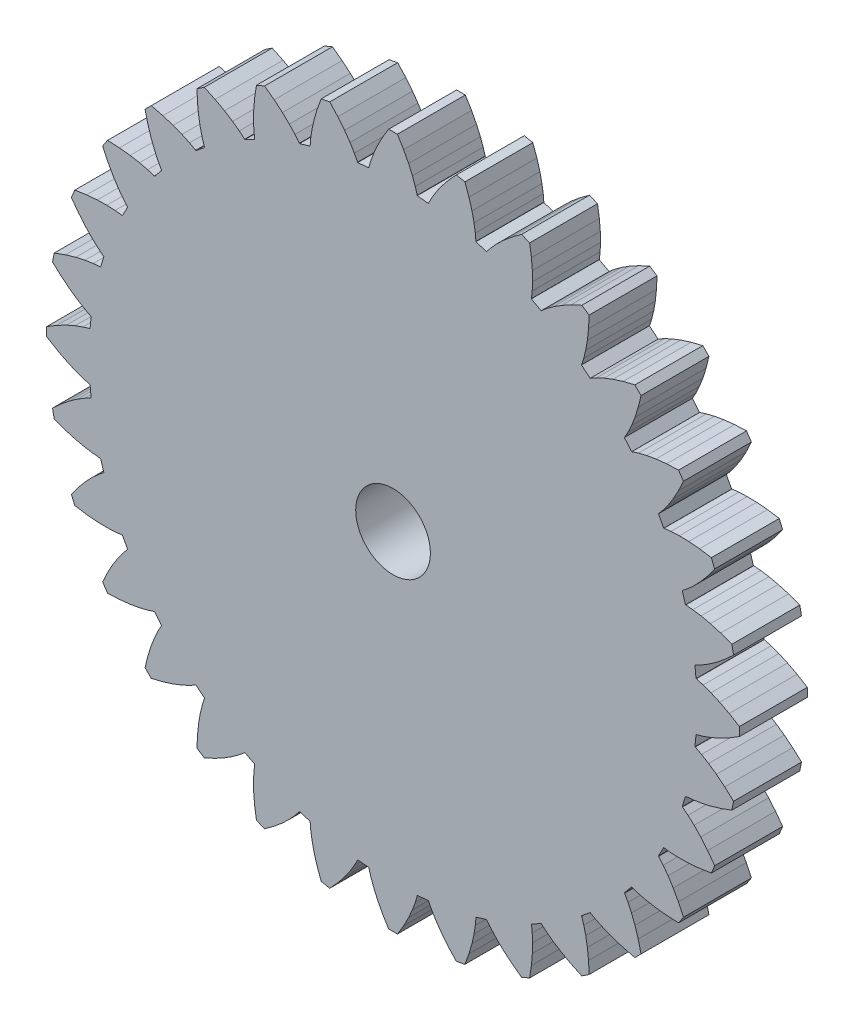
from build123d import *
from OCP.BRepFilletAPI import BRepFilletAPI_MakeChamfer

# Parameters (mm, degrees)
BOSS_EXTRUDE1_DEPTH  = 4.999999888
BOSS_EXTRUDE2_DEPTH  = 9.999999776
CUT_EXTRUDE1_DEPTH   = 40.748070134
CHAMFER1_SIZE        = 0.619803471
CHAMFER1_SIZE2       = 0.619822096
CHAMFER2_SIZE        = 0.619726875
CHAMFER2_SIZE2       = 0.619893824
CHAMFER3_SIZE        = 0.619793515
CHAMFER3_SIZE2       = 0.619793526
CHAMFER4_SIZE        = 0.619822096
CHAMFER4_SIZE2       = 0.619803471
CHAMFER5_SIZE        = 0.619726875
CHAMFER5_SIZE2       = 0.619893824
CHAMFER6_SIZE        = 0.619893824
CHAMFER6_SIZE2       = 0.619726875
CHAMFER7_SIZE        = 0.619893824
CHAMFER7_SIZE2       = 0.619726875
CHAMFER8_SIZE        = 0.619745054
CHAMFER8_SIZE2       = 0.619765581
CHAMFER9_SIZE        = 0.619714154
CHAMFER9_EDGE_2_SIZE = 0.619714154
CHAMFER9_EDGE_3_SIZE = 0.619714154
CHAMFER9_EDGE_4_SIZE = 0.619714154
CHAMFER10_SIZE       = 0.619765581
CHAMFER10_SIZE2      = 0.619745054
CHAMFER11_SIZE       = 0.619793526
CHAMFER11_SIZE2      = 0.619793515
SKETCH4_R            = 2.75
CUT_EXTRUDE2_DEPTH   = 4.999999888


with BuildPart() as part:
    # Sketch1 → Boss-Extrude1 (new body)
    with BuildSketch(Plane.XY.offset(4.999999888)):
        Polygon((1.778639969, 22.306099534), (1.780470018, 22.329099476), (1.634810003, 22.827899083), (1.425980008, 23.401200771), (1.143750036, 24.0423996), (0.778533984, 24.744199589), (7.504e-06, 26.027956983), (-0.778519025, 24.744199589), (-1.143740024, 24.0423996), (-1.425959985, 23.401200771), (-1.634799992, 22.827899083), (-1.780460007, 22.329099476), (-1.778629958, 22.306099534), (-2.607240109, 22.224500775), (-2.609919989, 22.247400135), (-2.850099932, 22.708199918), (-3.166760085, 23.229699582), (-3.568660002, 23.803599179), (-4.063770175, 24.420600384), (-5.077812133, 25.527785712), (-5.590910092, 24.116799235), (-5.812210031, 23.357300088), (-5.963909905, 22.673299536), (-6.056900136, 22.070299834), (-6.102450192, 21.552700549), (-6.096160039, 21.530499682), (-6.892929785, 21.288799122), (-6.900039967, 21.310800686), (-7.225490175, 21.715899929), (-7.637800183, 22.16560021), (-8.143940009, 22.649999708), (-8.749909699, 23.158600554), (-9.960546657, 24.046648865), (-10.188399814, 22.562699392), (-10.257299989, 21.774599329), (-10.27270034, 21.074200049), (-10.246199556, 20.464599133), (-10.189900175, 19.948000088), (-10.179400444, 19.927499816), (-10.913699865, 19.534999505), (-10.924999602, 19.555099308), (-11.323199607, 19.889000803), (-11.815300211, 20.249599591), (-12.406200171, 20.625999197), (-13.099799864, 21.006500348), (-14.460307649, 21.641368666), (-14.39439971, 20.141499117), (-14.308200218, 19.355099648), (-14.186600223, 18.665099517), (-14.041800052, 18.072400242), (-13.885799795, 17.576800659), (-13.871500269, 17.558699474), (-14.515100047, 17.030499876), (-14.530099928, 17.047999427), (-14.985799789, 17.297700047), (-15.538799576, 17.555499449), (-16.191799194, 17.809299752), (-16.946300864, 18.047299236), (-18.404422827, 18.404422827), (-18.047299236, 16.946300864), (-17.809299752, 16.191799194), (-17.555499449, 15.538799576), (-17.297700047, 14.985799789), (-17.047999427, 14.530099928), (-17.030499876, 14.515100047), (-17.558699474, 13.871500269), (-17.576800659, 13.885799795), (-18.072400242, 14.041800052), (-18.665099517, 14.186600223), (-19.355099648, 14.308200218), (-20.141499117, 14.39439971), (-21.641368666, 14.460307649), (-21.006500348, 13.099799864), (-20.625999197, 12.406200171), (-20.249599591, 11.815300211), (-19.889000803, 11.323199607), (-19.555099308, 10.924999602), (-19.534999505, 10.913699865), (-19.927499816, 10.179400444), (-19.948000088, 10.189900175), (-20.464599133, 10.246199556), (-21.074200049, 10.27270034), (-21.774599329, 10.257299989), (-22.562699392, 10.188399814), (-24.046648865, 9.960546657), (-23.158600554, 8.749909699), (-22.649999708, 8.143940009), (-22.16560021, 7.637800183), (-21.715899929, 7.225490175), (-21.310800686, 6.900039967), (-21.288799122, 6.892929785), (-21.530499682, 6.096160039), (-21.552700549, 6.102450192), (-22.070299834, 6.056900136), (-22.673299536, 5.963909905), (-23.357300088, 5.812210031), (-24.116799235, 5.590910092), (-25.527785712, 5.077812133), (-24.420600384, 4.063770175), (-23.803599179, 3.568660002), (-23.229699582, 3.166760085), (-22.708199918, 2.850099932), (-22.247400135, 2.609919989), (-22.224500775, 2.607240109), (-22.306099534, 1.778639969), (-22.329099476, 1.780470018), (-22.827899083, 1.634810003), (-23.401200771, 1.425980008), (-24.0423996, 1.143750036), (-24.744199589, 0.778533984), (-26.027956983, 7.504e-06), (-24.744199589, -0.778519025), (-24.0423996, -1.143740024), (-23.401200771, -1.425959985), (-22.827899083, -1.634799992), (-22.329099476, -1.780460007), (-22.306099534, -1.778629958), (-22.224500775, -2.607240109), (-22.247400135, -2.609919989), (-22.708199918, -2.850099932), (-23.229699582, -3.166760085), (-23.803599179, -3.568660002), (-24.420600384, -4.063770175), (-25.527785712, -5.077812133), (-24.116799235, -5.590910092), (-23.357300088, -5.812210031), (-22.673299536, -5.963909905), (-22.070299834, -6.056900136), (-21.552700549, -6.102450192), (-21.530499682, -6.096160039), (-21.288799122, -6.892929785), (-21.310800686, -6.900039967), (-21.715899929, -7.225490175), (-22.16560021, -7.637800183), (-22.649999708, -8.143940009), (-23.158600554, -8.749909699), (-24.046648865, -9.960546657), (-22.562699392, -10.188399814), (-21.774599329, -10.257299989), (-21.074200049, -10.27270034), (-20.464599133, -10.246199556), (-19.948000088, -10.189900175), (-19.927499816, -10.179400444), (-19.534999505, -10.913699865), (-19.555099308, -10.924999602), (-19.889000803, -11.323199607), (-20.249599591, -11.815300211), (-20.625999197, -12.406200171), (-21.006500348, -13.099799864), (-21.641368666, -14.460307649), (-20.141499117, -14.39439971), (-19.355099648, -14.308200218), (-18.665099517, -14.186600223), (-18.072400242, -14.041800052), (-17.576800659, -13.885799795), (-17.558699474, -13.871500269), (-17.030499876, -14.515100047), (-17.047999427, -14.530099928), (-17.297700047, -14.985799789), (-17.555499449, -15.538799576), (-17.809299752, -16.191799194), (-18.047299236, -16.946300864), (-18.404422827, -18.404422827), (-16.946300864, -18.047299236), (-16.191799194, -17.809299752), (-15.538799576, -17.555499449), (-14.985799789, -17.297700047), (-14.530099928, -17.047999427), (-14.515100047, -17.030499876), (-13.871500269, -17.558699474), (-13.885799795, -17.576800659), (-14.041800052, -18.072400242), (-14.186600223, -18.665099517), (-14.308200218, -19.355099648), (-14.39439971, -20.141499117), (-14.460307649, -21.641368666), (-13.099799864, -21.006500348), (-12.406200171, -20.625999197), (-11.815300211, -20.249599591), (-11.323199607, -19.889000803), (-10.924999602, -19.555099308), (-10.913699865, -19.534999505), (-10.179400444, -19.927499816), (-10.189900175, -19.948000088), (-10.246199556, -20.464599133), (-10.27270034, -21.074200049), (-10.257299989, -21.774599329), (-10.188399814, -22.562699392), (-9.960546657, -24.046648865), (-8.749909699, -23.158600554), (-8.143940009, -22.649999708), (-7.637800183, -22.16560021), (-7.225490175, -21.715899929), (-6.900039967, -21.310800686), (-6.892929785, -21.288799122), (-6.096160039, -21.530499682), (-6.102450192, -21.552700549), (-6.056900136, -22.070299834), (-5.963909905, -22.673299536), (-5.812210031, -23.357300088), (-5.590910092, -24.116799235), (-5.077812133, -25.527785712), (-4.063770175, -24.420600384), (-3.568660002, -23.803599179), (-3.166760085, -23.229699582), (-2.850099932, -22.708199918), (-2.609919989, -22.247400135), (-2.607240109, -22.224500775), (-1.778639969, -22.306099534), (-1.780470018, -22.329099476), (-1.634810003, -22.827899083), (-1.425980008, -23.401200771), (-1.143750036, -24.0423996), (-0.778533984, -24.744199589), (-7.504e-06, -26.027956983), (0.778519025, -24.744199589), (1.143740024, -24.0423996), (1.425959985, -23.401200771), (1.634799992, -22.827899083), (1.780460007, -22.329099476), (1.778629958, -22.306099534), (2.607240109, -22.224500775), (2.609919989, -22.247400135), (2.850099932, -22.708199918), (3.166760085, -23.229699582), (3.568660002, -23.803599179), (4.063770175, -24.420600384), (5.077812133, -25.527785712), (5.590910092, -24.116799235), (5.812210031, -23.357300088), (5.963909905, -22.673299536), (6.056900136, -22.070299834), (6.102450192, -21.552700549), (6.096160039, -21.530499682), (6.892929785, -21.288799122), (6.900039967, -21.310800686), (7.225490175, -21.715899929), (7.637800183, -22.16560021), (8.143940009, -22.649999708), (8.749909699, -23.158600554), (9.960546657, -24.046648865), (10.188399814, -22.562699392), (10.257299989, -21.774599329), (10.27270034, -21.074200049), (10.246199556, -20.464599133), (10.189900175, -19.948000088), (10.179400444, -19.927499816), (10.913699865, -19.534999505), (10.924999602, -19.555099308), (11.323199607, -19.889000803), (11.815300211, -20.249599591), (12.406200171, -20.625999197), (13.099799864, -21.006500348), (14.460307649, -21.641368666), (14.39439971, -20.141499117), (14.308200218, -19.355099648), (14.186600223, -18.665099517), (14.041800052, -18.072400242), (13.885799795, -17.576800659), (13.871500269, -17.558699474), (14.515100047, -17.030499876), (14.530099928, -17.047999427), (14.985799789, -17.297700047), (15.538799576, -17.555499449), (16.191799194, -17.809299752), (16.946300864, -18.047299236), (18.404422827, -18.404422827), (18.047299236, -16.946300864), (17.809299752, -16.191799194), (17.555499449, -15.538799576), (17.297700047, -14.985799789), (17.047999427, -14.530099928), (17.030499876, -14.515100047), (17.558699474, -13.871500269), (17.576800659, -13.885799795), (18.072400242, -14.041800052), (18.665099517, -14.186600223), (19.355099648, -14.308200218), (20.141499117, -14.39439971), (21.641368666, -14.460307649), (21.006500348, -13.099799864), (20.625999197, -12.406200171), (20.249599591, -11.815300211), (19.889000803, -11.323199607), (19.555099308, -10.924999602), (19.534999505, -10.913699865), (19.927499816, -10.179400444), (19.948000088, -10.189900175), (20.464599133, -10.246199556), (21.074200049, -10.27270034), (21.774599329, -10.257299989), (22.562699392, -10.188399814), (24.046648865, -9.960546657), (23.158600554, -8.749909699), (22.649999708, -8.143940009), (22.16560021, -7.637800183), (21.715899929, -7.225490175), (21.310800686, -6.900039967), (21.288799122, -6.892929785), (21.530499682, -6.096160039), (21.552700549, -6.102450192), (22.070299834, -6.056900136), (22.673299536, -5.963909905), (23.357300088, -5.812210031), (24.116799235, -5.590910092), (25.527785712, -5.077812133), (24.420600384, -4.063770175), (23.803599179, -3.568660002), (23.229699582, -3.166760085), (22.708199918, -2.850099932), (22.247400135, -2.609919989), (22.224500775, -2.607240109), (22.306099534, -1.778639969), (22.329099476, -1.780470018), (22.827899083, -1.634810003), (23.401200771, -1.425980008), (24.0423996, -1.143750036), (24.744199589, -0.778533984), (26.027956983, -7.504e-06), (24.744199589, 0.778519025), (24.0423996, 1.143740024), (23.401200771, 1.425959985), (22.827899083, 1.634799992), (22.329099476, 1.780460007), (22.306099534, 1.778629958), (22.224500775, 2.607240109), (22.247400135, 2.609919989), (22.708199918, 2.850099932), (23.229699582, 3.166760085), (23.803599179, 3.568660002), (24.420600384, 4.063770175), (25.527785712, 5.077812133), (24.116799235, 5.590910092), (23.357300088, 5.812210031), (22.673299536, 5.963909905), (22.070299834, 6.056900136), (21.552700549, 6.102450192), (21.530499682, 6.096160039), (21.288799122, 6.892929785), (21.310800686, 6.900039967), (21.715899929, 7.225490175), (22.16560021, 7.637800183), (22.649999708, 8.143940009), (23.158600554, 8.749909699), (24.046648865, 9.960546657), (22.562699392, 10.188399814), (21.774599329, 10.257299989), (21.074200049, 10.27270034), (20.464599133, 10.246199556), (19.948000088, 10.189900175), (19.927499816, 10.179400444), (19.534999505, 10.913699865), (19.555099308, 10.924999602), (19.889000803, 11.323199607), (20.249599591, 11.815300211), (20.625999197, 12.406200171), (21.006500348, 13.099799864), (21.641368666, 14.460307649), (20.141499117, 14.39439971), (19.355099648, 14.308200218), (18.665099517, 14.186600223), (18.072400242, 14.041800052), (17.576800659, 13.885799795), (17.558699474, 13.871500269), (17.030499876, 14.515100047), (17.047999427, 14.530099928), (17.297700047, 14.985799789), (17.555499449, 15.538799576), (17.809299752, 16.191799194), (18.047299236, 16.946300864), (18.404422827, 18.404422827), (16.946300864, 18.047299236), (16.191799194, 17.809299752), (15.538799576, 17.555499449), (14.985799789, 17.297700047), (14.530099928, 17.047999427), (14.515100047, 17.030499876), (13.871500269, 17.558699474), (13.885799795, 17.576800659), (14.041800052, 18.072400242), (14.186600223, 18.665099517), (14.308200218, 19.355099648), (14.39439971, 20.141499117), (14.460307649, 21.641368666), (13.099799864, 21.006500348), (12.406200171, 20.625999197), (11.815300211, 20.249599591), (11.323199607, 19.889000803), (10.924999602, 19.555099308), (10.913699865, 19.534999505), (10.179400444, 19.927499816), (10.189900175, 19.948000088), (10.246199556, 20.464599133), (10.27270034, 21.074200049), (10.257299989, 21.774599329), (10.188399814, 22.562699392), (9.960546657, 24.046648865), (8.749909699, 23.158600554), (8.143940009, 22.649999708), (7.637800183, 22.16560021), (7.225490175, 21.715899929), (6.900039967, 21.310800686), (6.892929785, 21.288799122), (6.096160039, 21.530499682), (6.102450192, 21.552700549), (6.056900136, 22.070299834), (5.963909905, 22.673299536), (5.812210031, 23.357300088), (5.590910092, 24.116799235), (5.077812133, 25.527785712), (4.063770175, 24.420600384), (3.568660002, 23.803599179), (3.166760085, 23.229699582), (2.850099932, 22.708199918), (2.609919989, 22.247400135), (2.607240109, 22.224500775), align=None)
    extrude(amount=-BOSS_EXTRUDE1_DEPTH)

    # Sketch2 → Boss-Extrude2 (add)
    with BuildSketch(Plane.XY.offset(4.999999888)):
        Polygon((-7.499999832, 0), (-7.244439796, 1.941140043), (-6.495189853, 3.749999916), (-5.303299986, 5.303299986), (-3.749999916, 6.495189853), (-1.941140043, 7.244439796), (0, 7.499999832), (1.941140043, 7.244439796), (3.749999916, 6.495189853), (5.303299986, 5.303299986), (6.495189853, 3.749999916), (7.244439796, 1.941140043), (7.499999832, 0), (7.244439796, -1.941140043), (6.495189853, -3.749999916), (5.303299986, -5.303299986), (3.749999916, -6.495189853), (1.941140043, -7.244439796), (0, -7.499999832), (-1.941140043, -7.244439796), (-3.749999916, -6.495189853), (-5.303299986, -5.303299986), (-6.495189853, -3.749999916), (-7.244439796, -1.941140043), align=None)
    extrude(amount=BOSS_EXTRUDE2_DEPTH)

    # Sketch3 → Cut-Extrude1 (cut, through all)
    with BuildSketch(Plane(origin=(0, 0, 0), x_dir=(-1, 0, 0), z_dir=(0, 0, -1))):
        Polygon((1.767770038, 1.767770038), (0, 2.499999944), (-1.767770038, 1.767770038), (-2.499999944, 0), (-1.767770038, -1.767770038), (0, -2.499999944), (1.767770038, -1.767770038), (2.499999944, 0), align=None)
    extrude(amount=-CUT_EXTRUDE1_DEPTH, mode=Mode.SUBTRACT)

    # Chamfer1: one chamfer whose edges measure the first distance from different faces: ONE call of the kernel's chamfer builder (chamfer() names one face for all edges)
    chamfer1_edges_1 = [part.edges().sort_by_distance(p)[0] for p in [
        (25.527785712, -5.077812133, 2.499999944),
    ]]
    chamfer1_side_1 = [part.faces().sort_by_distance(p)[0] for p in [
        (24.974193048, -4.570791154, 2.499999944),
    ]]
    chamfer1_edges_2 = [part.edges().sort_by_distance(p)[0] for p in [
        (-5.077812133, -25.527785712, 2.499999944),
    ]]
    chamfer1_side_2 = [part.faces().sort_by_distance(p)[0] for p in [
        (-5.334361112, -24.822292473, 2.499999944),
    ]]
    chamfer1_edges_3 = [part.edges().sort_by_distance(p)[0] for p in [
        (-25.527785712, 5.077812133, 2.499999944),
    ]]
    chamfer1_side_3 = [part.faces().sort_by_distance(p)[0] for p in [
        (-24.822292473, 5.334361112, 2.499999944),
    ]]
    chamfer1_edges_4 = [part.edges().sort_by_distance(p)[0] for p in [
        (-5.077812133, 25.527785712, 2.499999944),
    ]]
    chamfer1_side_4 = [part.faces().sort_by_distance(p)[0] for p in [
        (-4.570791154, 24.974193048, 2.499999944),
    ]]
    chamfer1 = BRepFilletAPI_MakeChamfer(part.part.solid().wrapped)
    for e in chamfer1_edges_1:
        chamfer1.Add(CHAMFER1_SIZE, CHAMFER1_SIZE2, e.wrapped, chamfer1_side_1[0].wrapped)  # the first distance lies on this face
    for e in chamfer1_edges_2:
        chamfer1.Add(CHAMFER1_SIZE, CHAMFER1_SIZE2, e.wrapped, chamfer1_side_2[0].wrapped)  # the first distance lies on this face
    for e in chamfer1_edges_3:
        chamfer1.Add(CHAMFER1_SIZE, CHAMFER1_SIZE2, e.wrapped, chamfer1_side_3[0].wrapped)  # the first distance lies on this face
    for e in chamfer1_edges_4:
        chamfer1.Add(CHAMFER1_SIZE, CHAMFER1_SIZE2, e.wrapped, chamfer1_side_4[0].wrapped)  # the first distance lies on this face
    add(Compound.cast(chamfer1.Shape()), mode=Mode.REPLACE)

    # Chamfer2: one chamfer whose edges measure the first distance from different faces: ONE call of the kernel's chamfer builder (chamfer() names one face for all edges)
    chamfer2_edges_1 = [part.edges().sort_by_distance(p)[0] for p in [
        (24.046648865, -9.960546657, 2.499999944),
    ]]
    chamfer2_side_1 = [part.faces().sort_by_distance(p)[0] for p in [
        (23.602624709, -9.355228178, 2.499999944),
    ]]
    chamfer2_edges_2 = [part.edges().sort_by_distance(p)[0] for p in [
        (-24.046648865, -9.960546657, 2.499999944),
    ]]
    chamfer2_side_2 = [part.faces().sort_by_distance(p)[0] for p in [
        (-23.602624709, -9.355228178, 2.499999944),
    ]]
    chamfer2_edges_3 = [part.edges().sort_by_distance(p)[0] for p in [
        (-24.046648865, 9.960546657, 2.499999944),
    ]]
    chamfer2_side_3 = [part.faces().sort_by_distance(p)[0] for p in [
        (-23.304674129, 10.074473236, 2.499999944),
    ]]
    chamfer2 = BRepFilletAPI_MakeChamfer(part.part.solid().wrapped)
    for e in chamfer2_edges_1:
        chamfer2.Add(CHAMFER2_SIZE, CHAMFER2_SIZE2, e.wrapped, chamfer2_side_1[0].wrapped)  # the first distance lies on this face
    for e in chamfer2_edges_2:
        chamfer2.Add(CHAMFER2_SIZE, CHAMFER2_SIZE2, e.wrapped, chamfer2_side_2[0].wrapped)  # the first distance lies on this face
    for e in chamfer2_edges_3:
        chamfer2.Add(CHAMFER2_SIZE, CHAMFER2_SIZE2, e.wrapped, chamfer2_side_3[0].wrapped)  # the first distance lies on this face
    add(Compound.cast(chamfer2.Shape()), mode=Mode.REPLACE)

    # Chamfer3: one chamfer whose edges measure the first distance from different faces: ONE call of the kernel's chamfer builder (chamfer() names one face for all edges)
    chamfer3_edges_1 = [part.edges().sort_by_distance(p)[0] for p in [
        (26.027956983, -7.504e-06, 2.499999944),
    ]]
    chamfer3_side_1 = [part.faces().sort_by_distance(p)[0] for p in [
        (25.386078286, 0.38925576, 2.499999944),
    ]]
    chamfer3_edges_2 = [part.edges().sort_by_distance(p)[0] for p in [
        (-26.027956983, 7.504e-06, 2.499999944),
    ]]
    chamfer3_side_2 = [part.faces().sort_by_distance(p)[0] for p in [
        (-25.386078286, 0.389270744, 2.499999944),
    ]]
    chamfer3 = BRepFilletAPI_MakeChamfer(part.part.solid().wrapped)
    for e in chamfer3_edges_1:
        chamfer3.Add(CHAMFER3_SIZE, CHAMFER3_SIZE2, e.wrapped, chamfer3_side_1[0].wrapped)  # the first distance lies on this face
    for e in chamfer3_edges_2:
        chamfer3.Add(CHAMFER3_SIZE, CHAMFER3_SIZE2, e.wrapped, chamfer3_side_2[0].wrapped)  # the first distance lies on this face
    add(Compound.cast(chamfer3.Shape()), mode=Mode.REPLACE)

    # Chamfer4: one chamfer whose edges measure the first distance from different faces: ONE call of the kernel's chamfer builder (chamfer() names one face for all edges)
    chamfer4_edges_1 = [part.edges().sort_by_distance(p)[0] for p in [
        (5.077812133, 25.527785712, 2.499999944),
    ]]
    chamfer4_side_1 = [part.faces().sort_by_distance(p)[0] for p in [
        (4.570791154, 24.974193048, 2.499999944),
    ]]
    chamfer4_edges_2 = [part.edges().sort_by_distance(p)[0] for p in [
        (25.527785712, 5.077812133, 2.499999944),
    ]]
    chamfer4_side_2 = [part.faces().sort_by_distance(p)[0] for p in [
        (24.822292473, 5.334361112, 2.499999944),
    ]]
    chamfer4_edges_3 = [part.edges().sort_by_distance(p)[0] for p in [
        (5.077812133, -25.527785712, 2.499999944),
    ]]
    chamfer4_side_3 = [part.faces().sort_by_distance(p)[0] for p in [
        (4.570791154, -24.974193048, 2.499999944),
    ]]
    chamfer4_edges_4 = [part.edges().sort_by_distance(p)[0] for p in [
        (-25.527785712, -5.077812133, 2.499999944),
    ]]
    chamfer4_side_4 = [part.faces().sort_by_distance(p)[0] for p in [
        (-24.974193048, -4.570791154, 2.499999944),
    ]]
    chamfer4 = BRepFilletAPI_MakeChamfer(part.part.solid().wrapped)
    for e in chamfer4_edges_1:
        chamfer4.Add(CHAMFER4_SIZE, CHAMFER4_SIZE2, e.wrapped, chamfer4_side_1[0].wrapped)  # the first distance lies on this face
    for e in chamfer4_edges_2:
        chamfer4.Add(CHAMFER4_SIZE, CHAMFER4_SIZE2, e.wrapped, chamfer4_side_2[0].wrapped)  # the first distance lies on this face
    for e in chamfer4_edges_3:
        chamfer4.Add(CHAMFER4_SIZE, CHAMFER4_SIZE2, e.wrapped, chamfer4_side_3[0].wrapped)  # the first distance lies on this face
    for e in chamfer4_edges_4:
        chamfer4.Add(CHAMFER4_SIZE, CHAMFER4_SIZE2, e.wrapped, chamfer4_side_4[0].wrapped)  # the first distance lies on this face
    add(Compound.cast(chamfer4.Shape()), mode=Mode.REPLACE)

    # Chamfer5: one chamfer whose edges measure the first distance from different faces: ONE call of the kernel's chamfer builder (chamfer() names one face for all edges)
    chamfer5_edges_1 = [part.edges().sort_by_distance(p)[0] for p in [
        (9.960546657, 24.046648865, 2.499999944),
    ]]
    chamfer5_side_1 = [part.faces().sort_by_distance(p)[0] for p in [
        (9.355228178, 23.602624709, 2.499999944),
    ]]
    chamfer5_edges_2 = [part.edges().sort_by_distance(p)[0] for p in [
        (9.960546657, -24.046648865, 2.499999944),
    ]]
    chamfer5_side_2 = [part.faces().sort_by_distance(p)[0] for p in [
        (9.355228178, -23.602624709, 2.499999944),
    ]]
    chamfer5_edges_3 = [part.edges().sort_by_distance(p)[0] for p in [
        (-9.960546657, 24.046648865, 2.499999944),
    ]]
    chamfer5_side_3 = [part.faces().sort_by_distance(p)[0] for p in [
        (-10.074473236, 23.304674129, 2.499999944),
    ]]
    chamfer5 = BRepFilletAPI_MakeChamfer(part.part.solid().wrapped)
    for e in chamfer5_edges_1:
        chamfer5.Add(CHAMFER5_SIZE, CHAMFER5_SIZE2, e.wrapped, chamfer5_side_1[0].wrapped)  # the first distance lies on this face
    for e in chamfer5_edges_2:
        chamfer5.Add(CHAMFER5_SIZE, CHAMFER5_SIZE2, e.wrapped, chamfer5_side_2[0].wrapped)  # the first distance lies on this face
    for e in chamfer5_edges_3:
        chamfer5.Add(CHAMFER5_SIZE, CHAMFER5_SIZE2, e.wrapped, chamfer5_side_3[0].wrapped)  # the first distance lies on this face
    add(Compound.cast(chamfer5.Shape()), mode=Mode.REPLACE)

    # Chamfer6
    chamfer6_edges = [part.edges().sort_by_distance(p)[0] for p in [
        (-9.960546657, -24.046648865, 2.499999944),
    ]]
    chamfer6_side = [part.faces().sort_by_distance(p)[0] for p in [
        (-10.074473236, -23.304674129, 2.499999944),
    ]]
    chamfer(chamfer6_edges, length=CHAMFER6_SIZE, length2=CHAMFER6_SIZE2, reference=chamfer6_side[0])

    # Chamfer7
    chamfer7_edges = [part.edges().sort_by_distance(p)[0] for p in [
        (24.046648865, 9.960546657, 2.499999944),
    ]]
    chamfer7_side = [part.faces().sort_by_distance(p)[0] for p in [
        (23.602624709, 9.355228178, 2.499999944),
    ]]
    chamfer(chamfer7_edges, length=CHAMFER7_SIZE, length2=CHAMFER7_SIZE2, reference=chamfer7_side[0])

    # Chamfer8: one chamfer whose edges measure the first distance from different faces: ONE call of the kernel's chamfer builder (chamfer() names one face for all edges)
    chamfer8_edges_1 = [part.edges().sort_by_distance(p)[0] for p in [
        (21.641368666, 14.460307649, 2.499999944),
    ]]
    chamfer8_side_1 = [part.faces().sort_by_distance(p)[0] for p in [
        (21.323934507, 13.780053757, 2.499999944),
    ]]
    chamfer8_edges_2 = [part.edges().sort_by_distance(p)[0] for p in [
        (14.460307649, -21.641368666, 2.499999944),
    ]]
    chamfer8_side_2 = [part.faces().sort_by_distance(p)[0] for p in [
        (14.42735368, -20.891433892, 2.499999944),
    ]]
    chamfer8_edges_3 = [part.edges().sort_by_distance(p)[0] for p in [
        (-14.460307649, -21.641368666, 2.499999944),
    ]]
    chamfer8_side_3 = [part.faces().sort_by_distance(p)[0] for p in [
        (-13.780053757, -21.323934507, 2.499999944),
    ]]
    chamfer8_edges_4 = [part.edges().sort_by_distance(p)[0] for p in [
        (-14.460307649, 21.641368666, 2.499999944),
    ]]
    chamfer8_side_4 = [part.faces().sort_by_distance(p)[0] for p in [
        (-13.780053757, 21.323934507, 2.499999944),
    ]]
    chamfer8 = BRepFilletAPI_MakeChamfer(part.part.solid().wrapped)
    for e in chamfer8_edges_1:
        chamfer8.Add(CHAMFER8_SIZE, CHAMFER8_SIZE2, e.wrapped, chamfer8_side_1[0].wrapped)  # the first distance lies on this face
    for e in chamfer8_edges_2:
        chamfer8.Add(CHAMFER8_SIZE, CHAMFER8_SIZE2, e.wrapped, chamfer8_side_2[0].wrapped)  # the first distance lies on this face
    for e in chamfer8_edges_3:
        chamfer8.Add(CHAMFER8_SIZE, CHAMFER8_SIZE2, e.wrapped, chamfer8_side_3[0].wrapped)  # the first distance lies on this face
    for e in chamfer8_edges_4:
        chamfer8.Add(CHAMFER8_SIZE, CHAMFER8_SIZE2, e.wrapped, chamfer8_side_4[0].wrapped)  # the first distance lies on this face
    add(Compound.cast(chamfer8.Shape()), mode=Mode.REPLACE)

    # Chamfer9
    chamfer9_edges = [part.edges().sort_by_distance(p)[0] for p in [
        (18.404422827, 18.404422827, 2.499999944),
    ]]
    chamfer(chamfer9_edges, length=CHAMFER9_SIZE)

    # Chamfer9 edge 2
    chamfer9_edge_2_edges = [part.edges().sort_by_distance(p)[0] for p in [
        (18.404422827, -18.404422827, 2.499999944),
    ]]
    chamfer(chamfer9_edge_2_edges, length=CHAMFER9_EDGE_2_SIZE)

    # Chamfer9 edge 3
    chamfer9_edge_3_edges = [part.edges().sort_by_distance(p)[0] for p in [
        (-18.404422827, -18.404422827, 2.499999944),
    ]]
    chamfer(chamfer9_edge_3_edges, length=CHAMFER9_EDGE_3_SIZE)

    # Chamfer9 edge 4
    chamfer9_edge_4_edges = [part.edges().sort_by_distance(p)[0] for p in [
        (-18.404422827, 18.404422827, 2.499999944),
    ]]
    chamfer(chamfer9_edge_4_edges, length=CHAMFER9_EDGE_4_SIZE)

    # Chamfer10: one chamfer whose edges measure the first distance from different faces: ONE call of the kernel's chamfer builder (chamfer() names one face for all edges)
    chamfer10_edges_1 = [part.edges().sort_by_distance(p)[0] for p in [
        (14.460307649, 21.641368666, 2.499999944),
    ]]
    chamfer10_side_1 = [part.faces().sort_by_distance(p)[0] for p in [
        (13.780053757, 21.323934507, 2.499999944),
    ]]
    chamfer10_edges_2 = [part.edges().sort_by_distance(p)[0] for p in [
        (21.641368666, -14.460307649, 2.499999944),
    ]]
    chamfer10_side_2 = [part.faces().sort_by_distance(p)[0] for p in [
        (21.323934507, -13.780053757, 2.499999944),
    ]]
    chamfer10_edges_3 = [part.edges().sort_by_distance(p)[0] for p in [
        (-21.641368666, -14.460307649, 2.499999944),
    ]]
    chamfer10_side_3 = [part.faces().sort_by_distance(p)[0] for p in [
        (-21.323934507, -13.780053757, 2.499999944),
    ]]
    chamfer10_edges_4 = [part.edges().sort_by_distance(p)[0] for p in [
        (-21.641368666, 14.460307649, 2.499999944),
    ]]
    chamfer10_side_4 = [part.faces().sort_by_distance(p)[0] for p in [
        (-20.891433892, 14.42735368, 2.499999944),
    ]]
    chamfer10 = BRepFilletAPI_MakeChamfer(part.part.solid().wrapped)
    for e in chamfer10_edges_1:
        chamfer10.Add(CHAMFER10_SIZE, CHAMFER10_SIZE2, e.wrapped, chamfer10_side_1[0].wrapped)  # the first distance lies on this face
    for e in chamfer10_edges_2:
        chamfer10.Add(CHAMFER10_SIZE, CHAMFER10_SIZE2, e.wrapped, chamfer10_side_2[0].wrapped)  # the first distance lies on this face
    for e in chamfer10_edges_3:
        chamfer10.Add(CHAMFER10_SIZE, CHAMFER10_SIZE2, e.wrapped, chamfer10_side_3[0].wrapped)  # the first distance lies on this face
    for e in chamfer10_edges_4:
        chamfer10.Add(CHAMFER10_SIZE, CHAMFER10_SIZE2, e.wrapped, chamfer10_side_4[0].wrapped)  # the first distance lies on this face
    add(Compound.cast(chamfer10.Shape()), mode=Mode.REPLACE)

    # Chamfer11: one chamfer whose edges measure the first distance from different faces: ONE call of the kernel's chamfer builder (chamfer() names one face for all edges)
    chamfer11_edges_1 = [part.edges().sort_by_distance(p)[0] for p in [
        (-7.504e-06, -26.027956983, 2.499999944),
    ]]
    chamfer11_side_1 = [part.faces().sort_by_distance(p)[0] for p in [
        (-0.389270744, -25.386078286, 2.499999944),
    ]]
    chamfer11_edges_2 = [part.edges().sort_by_distance(p)[0] for p in [
        (7.504e-06, 26.027956983, 2.499999944),
    ]]
    chamfer11_side_2 = [part.faces().sort_by_distance(p)[0] for p in [
        (-0.38925576, 25.386078286, 2.499999944),
    ]]
    chamfer11 = BRepFilletAPI_MakeChamfer(part.part.solid().wrapped)
    for e in chamfer11_edges_1:
        chamfer11.Add(CHAMFER11_SIZE, CHAMFER11_SIZE2, e.wrapped, chamfer11_side_1[0].wrapped)  # the first distance lies on this face
    for e in chamfer11_edges_2:
        chamfer11.Add(CHAMFER11_SIZE, CHAMFER11_SIZE2, e.wrapped, chamfer11_side_2[0].wrapped)  # the first distance lies on this face
    add(Compound.cast(chamfer11.Shape()), mode=Mode.REPLACE)

    # SurfaceCut1
    split(bisect_by=Plane.XY.offset(4.999999888), keep=Keep.BOTTOM)

    # Sketch4 → Cut-Extrude2 (cut)
    with BuildSketch(Plane(origin=(0, 0, 0), x_dir=(-1, 0, 0), z_dir=(0, 0, -1))):
        Circle(SKETCH4_R)
    extrude(amount=-CUT_EXTRUDE2_DEPTH, mode=Mode.SUBTRACT)


solid = part.part
